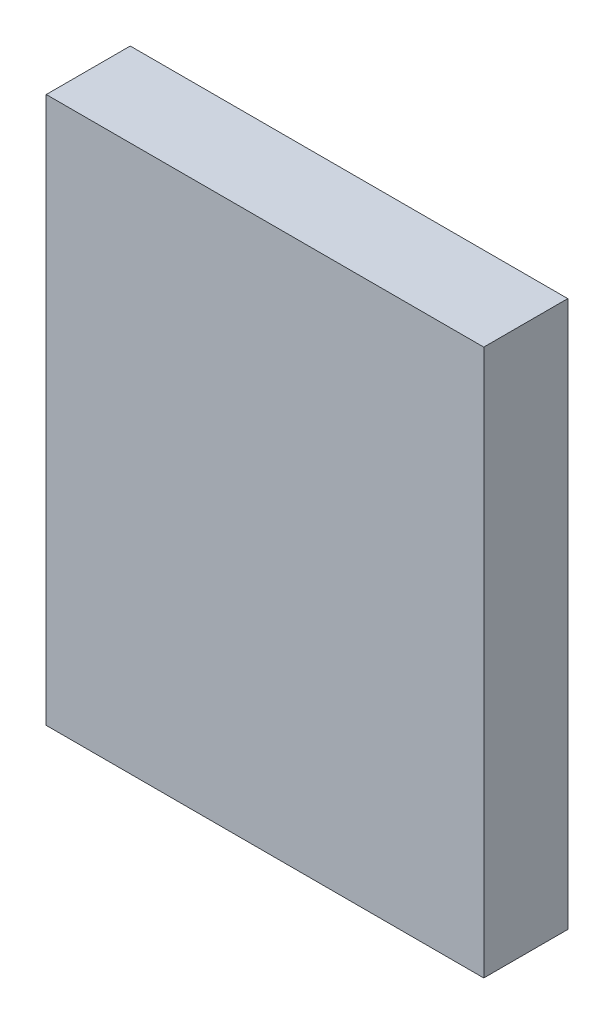
from build123d import *

# Parameters (mm, degrees)
SKETCH1_W          = 16.536008519
SKETCH1_H          = 20.650267989
BASE_FLANGE1_DEPTH = 3.175


# Sheet-metal steps are written as plain solids
with BuildPart() as part:
    # Sketch1 → Base-Flange1 (new body)
    with BuildSketch(Plane.XY.offset(-1973.812495)):
        with Locations((-360.952937726, -77.757480971)):
            Rectangle(SKETCH1_W, SKETCH1_H)
    extrude(amount=BASE_FLANGE1_DEPTH)


solid = part.part
